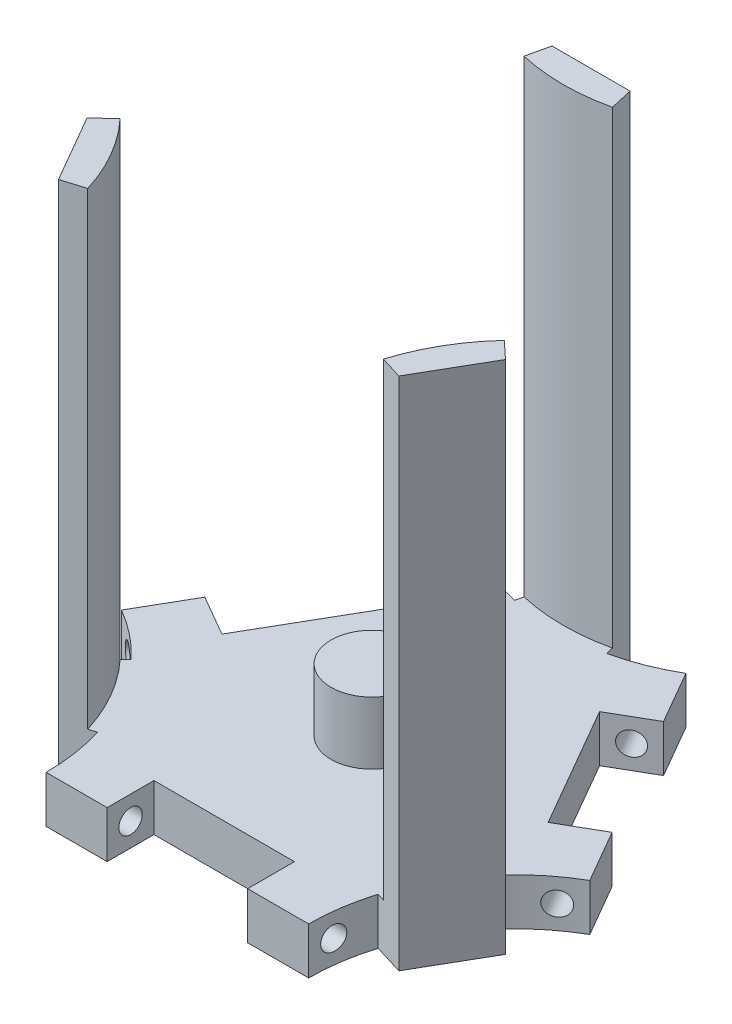
from build123d import *

# Parameters (mm, degrees)
BOSS_EXTRUDE1_DEPTH     = 3
SKETCH2_R               = 2.625
BOSS_EXTRUDE2_DEPTH     = 4
SKETCH3_W               = 9
SKETCH3_H               = 3
CUT_EXTRUDE1_DEPTH      = 46.717380795
CUT_EXTRUDE2_DEPTH      = 47.391760164
CUT_EXTRUDE2_DEPTH_BACK = 47.391760164
SKETCH4_R               = 0.75
CUT_EXTRUDE3_DEPTH      = 33.475581638
CUT_EXTRUDE3_DEPTH_BACK = 33.475581638
SKETCH5_R               = 0.75
CUT_EXTRUDE4_DEPTH      = 34.635958629
CUT_EXTRUDE4_DEPTH_BACK = 34.635958629
SKETCH6_R               = 0.75
BOSS_EXTRUDE3_DEPTH     = 30


with BuildPart() as part:
    # Sketch1 → Boss-Extrude1 (new body)
    with BuildSketch(Plane(origin=(0, 0, 0), x_dir=(1, 0, 0), z_dir=(0, 1, 0))):
        with BuildLine():
            Line((6.591682084, 11.417128277), (15, 25.980762114))
            ThreePointArc((15, 25.980762114), (16.768876635, 25.128389411), (18.644755802, 24.548267761))
            Line((18.644755802, 24.548267761), (19.091682084, 26.497692522))
            Line((19.091682084, 26.497692522), (24.091682084, 26.497692522))
            Line((24.091682084, 26.497692522), (24.538608366, 24.548267761))
            ThreePointArc((24.538608366, 24.548267761), (26.414487532, 25.128389411), (28.183364168, 25.980762114))
            Line((28.183364168, 25.980762114), (36.591682084, 11.417128277))
            ThreePointArc((36.591682084, 11.417128277), (34.969067352, 10.311422526), (33.528727683, 8.976924338))
            Line((33.528727683, 8.976924338), (34.993515908, 7.615162444))
            Line((34.993515908, 7.615162444), (32.493515908, 3.285035425))
            Line((32.493515908, 3.285035425), (30.581801401, 3.872698291))
            ThreePointArc((30.581801401, 3.872698291), (30.146261903, 1.958078454), (30, 0))
            Line((30, 0), (13.183364168, 0))
            ThreePointArc((13.183364168, 0), (13.037102264, 1.958078454), (12.601562767, 3.872698291))
            Line((12.601562767, 3.872698291), (10.68984826, 3.285035425))
            Line((10.68984826, 3.285035425), (8.18984826, 7.615162444))
            Line((8.18984826, 7.615162444), (9.654636485, 8.976924338))
            ThreePointArc((9.654636485, 8.976924338), (8.214296816, 10.311422526), (6.591682084, 11.417128277))
        make_face()
    extrude(amount=BOSS_EXTRUDE1_DEPTH)

    # Sketch2 → Boss-Extrude2 (add)
    with BuildSketch(Plane(origin=(0, 3, 0), x_dir=(1, 0, 0), z_dir=(0, 1, 0))):
        with Locations((21.591682084, 12.465963463)):
            Circle(SKETCH2_R)
    extrude(amount=BOSS_EXTRUDE2_DEPTH)

    # Sketch3 → Cut-Extrude1 (cut, through all)
    with BuildSketch(Plane.XZ):
        with Locations((21.591682084, -1.5)):
            Rectangle(SKETCH3_W, SKETCH3_H)
        Polygon((8.545841042, -14.801830878), (13.045841042, -22.596059512), (15.643917253, -21.096059512), (11.143917253, -13.301830878), align=None)
        Polygon((34.637523126, -14.801830878), (32.039446914, -13.301830878), (27.539446914, -21.096059512), (30.137523126, -22.596059512), align=None)
    extrude(amount=-CUT_EXTRUDE1_DEPTH, mode=Mode.SUBTRACT)

    # Sketch4 → Cut-Extrude2 (cut, two sides: drawn at the far end of the back side and taken through both)
    with BuildSketch(Plane(origin=(2.25, 0, 3.897114317), x_dir=(-0.8660254037844389, 0, 0.4999999999999997), z_dir=(-0.4999999999999997, 0, -0.8660254037844389)).offset(-CUT_EXTRUDE2_DEPTH_BACK)):
        with Locations((-35.89789039, 1.5)):
            Circle(SKETCH4_R)
    extrude(amount=CUT_EXTRUDE2_DEPTH + CUT_EXTRUDE2_DEPTH_BACK, mode=Mode.SUBTRACT)

    # Sketch5 → Cut-Extrude3 (cut, two sides: drawn at the far end of the back side and taken through both)
    with BuildSketch(Plane(origin=(8.545841042, 0, -14.801830878), x_dir=(-0.8660254037844383, 0, -0.5000000000000008), z_dir=(0.5000000000000007, 0, -0.8660254037844382)).offset(-CUT_EXTRUDE3_DEPTH_BACK)):
        with Locations((-1.5, 1.5)):
            Circle(SKETCH5_R)
    extrude(amount=CUT_EXTRUDE3_DEPTH + CUT_EXTRUDE3_DEPTH_BACK, mode=Mode.SUBTRACT)

    # Sketch6 → Cut-Extrude4 (cut, two sides: drawn at the far end of the back side and taken through both)
    with BuildSketch(Plane.ZY.offset(-26.091682084).offset(-CUT_EXTRUDE4_DEPTH_BACK)):
        with Locations((-1.5, 1.5)):
            Circle(SKETCH6_R)
    extrude(amount=CUT_EXTRUDE4_DEPTH + CUT_EXTRUDE4_DEPTH_BACK, mode=Mode.SUBTRACT)

    # Sketch7 → Boss-Extrude3 (add)
    with BuildSketch(Plane(origin=(0, 3, 0), x_dir=(1, 0, 0), z_dir=(0, 1, 0))):
        with BuildLine():
            Line((8.18984826, 7.615162444), (10.68984826, 3.285035425))
            Line((10.68984826, 3.285035425), (12.12363414, 3.725782575))
            ThreePointArc((12.12363414, 3.725782575), (10.983890093, 6.341551902), (9.288439429, 8.636483864))
            Line((9.288439429, 8.636483864), (8.18984826, 7.615162444))
        make_face()
        with BuildLine():
            Line((32.493515908, 3.285035425), (34.993515908, 7.615162444))
            Line((34.993515908, 7.615162444), (33.894924739, 8.636483864))
            ThreePointArc((33.894924739, 8.636483864), (32.199474075, 6.341551902), (31.059730028, 3.725782575))
            Line((31.059730028, 3.725782575), (32.493515908, 3.285035425))
        make_face()
        with BuildLine():
            Line((19.091682084, 26.497692522), (24.091682084, 26.497692522))
            Line((24.091682084, 26.497692522), (24.426876795, 25.035623951))
            ThreePointArc((24.426876795, 25.035623951), (21.591682084, 24.714786587), (18.756487372, 25.035623951))
            Line((18.756487372, 25.035623951), (19.091682084, 26.497692522))
        make_face()
    extrude(amount=BOSS_EXTRUDE3_DEPTH)


solid = part.part
